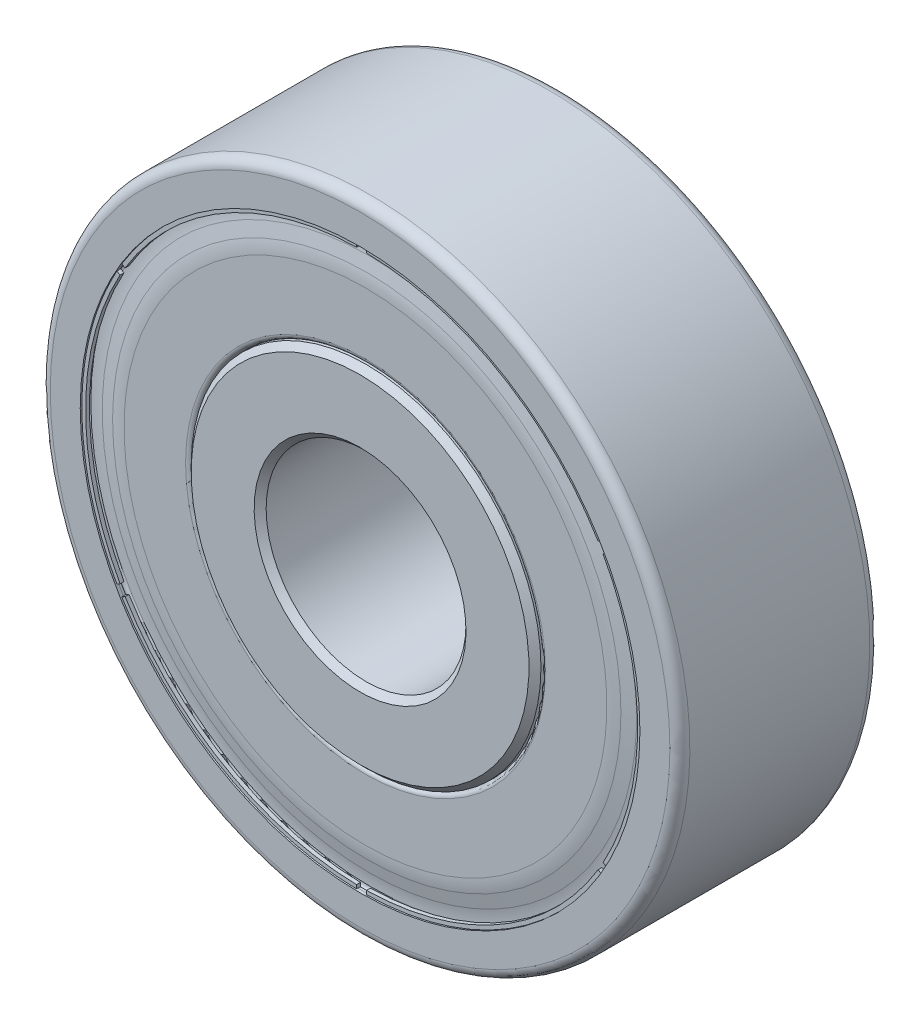
from build123d import *

# Parameters (mm, degrees)
CHAMFER1_SIZE      = 0.15
CIRPATTERN1_COUNT  = 6
CUT_EXTRUDE1_REACH = 14.354
CIRPATTERN2_COUNT  = 6


with BuildPart() as part:
    # Sketch3 → Revolve1 (revolve)
    with BuildSketch(Plane(origin=(0, 0, 0), x_dir=(0, 0, -1), z_dir=(1, 0, 0)), mode=Mode.PRIVATE) as revolve1_sk:
        with BuildLine():
            Line((-2.5, 2.5), (2.5, 2.5))
            Line((2.5, 2.5), (2.5, 4.375))
            Line((2.5, 4.375), (0.847791248, 4.375))
            ThreePointArc((0.847791248, 4.375), (0, 4.125), (-0.847791248, 4.375))
            Line((-0.847791248, 4.375), (-2.5, 4.375))
            Line((-2.5, 4.375), (-2.5, 2.5))
        make_face()
        with BuildLine():
            Line((2.5, 7), (2.425, 7))
            ThreePointArc((2.425, 7), (2.310894468, 7.124524337), (2.176899031, 7.021706022))
            Line((2.176899031, 7.021706022), (2.102540881, 6.6))
            Line((2.102540881, 6.6), (1.268365089, 6.6))
            ThreePointArc((1.268365089, 6.6), (0, 7.25), (-1.268365089, 6.6))
            Line((-1.268365089, 6.6), (-2.102540881, 6.6))
            Line((-2.102540881, 6.6), (-2.176899031, 7.021706022))
            ThreePointArc((-2.176899031, 7.021706022), (-2.310894468, 7.124524337), (-2.425, 7))
            Line((-2.425, 7), (-2.5, 7))
            Line((-2.5, 7), (-2.5, 7.75))
            ThreePointArc((-2.5, 7.75), (-2.426776695, 7.926776695), (-2.25, 8))
            Line((-2.25, 8), (2.25, 8))
            ThreePointArc((2.25, 8), (2.426776695, 7.926776695), (2.5, 7.75))
            Line((2.5, 7.75), (2.5, 7))
        make_face()
    revolve(revolve1_sk.sketch.rotate(Axis((0, 0, 2.5), (0, 0, -1)), 180), axis=Axis((0, 0, 2.5), (0, 0, -1)))

    # Chamfer1
    chamfer1_edges = [part.edges().sort_by_distance(p)[0] for p in [
        (0, 4.375, 2.5),
        (0, 4.375, -2.5),
        (0, 2.5, -2.5),
        (0, 2.5, 2.5),
    ]]
    chamfer(chamfer1_edges, length=CHAMFER1_SIZE)


with BuildPart() as body_2:
    # Sketch4 → Revolve2 (revolve)
    with BuildSketch(Plane(origin=(0, 0, 0), x_dir=(0, 0, -1), z_dir=(1, 0, 0)), mode=Mode.PRIVATE) as revolve2_sk:
        with BuildLine():
            Line((-2.425, 7), (-2.4625, 7))
            Line((-2.4625, 7), (-2.4625, 6.904))
            Line((-2.4625, 6.904), (-2.365, 6.904))
            Line((-2.365, 6.904), (-2.365, 7))
            ThreePointArc((-2.365, 7), (-2.3, 7.065), (-2.235, 7))
            Line((-2.235, 7), (-2.235, 6.84))
            Line((-2.235, 6.84), (-2.365, 6.2))
            Line((-2.365, 6.2), (-2.365, 4.5))
            ThreePointArc((-2.365, 4.5), (-2.328388348, 4.411611652), (-2.24, 4.375))
            Line((-2.24, 4.375), (-1.531666667, 4.375))
            Line((-1.531666667, 4.375), (-1.531666667, 4.435))
            Line((-1.531666667, 4.435), (-2.24, 4.435))
            ThreePointArc((-2.24, 4.435), (-2.285961941, 4.454038059), (-2.305, 4.5))
            Line((-2.305, 4.5), (-2.305, 6.2))
            Line((-2.305, 6.2), (-2.175, 6.84))
            Line((-2.175, 6.84), (-2.175, 7))
            ThreePointArc((-2.175, 7), (-2.3, 7.125), (-2.425, 7))
        make_face()
    revolve(revolve2_sk.sketch.rotate(Axis((0, 0, 2.5), (0, 0, -1)), 180), axis=Axis((0, 0, 2.5), (0, 0, -1)))

    # Fillet1: read off the stored shape, not the designer's step
    # Fillet1 outline → Fillet1 (revolve, cut)
    with BuildSketch(Plane.XZ):
        with BuildLine():
            Line((6.357638344, 2.365), (6.039142465, 2.365))
            ThreePointArc((6.039142465, 2.365), (6.199193179, 2.356974802), (6.357638344, 2.332979711))
            Line((6.357638344, 2.332979711), (6.357638344, 2.365))
        make_face()
    revolve(axis=Axis((0, 0, 0), (0, 0, 1)), mode=Mode.SUBTRACT)

    # Fillet1 2 outline → Fillet1 2 (revolve)
    with BuildSketch(Plane.XZ):
        with BuildLine():
            ThreePointArc((7, 2.235), (6.84038078, 2.243067972), (6.68236279, 2.267020058))
            Line((6.68236279, 2.267020058), (6.68236279, 2.235))
            Line((6.68236279, 2.235), (7, 2.235))
        make_face()
    revolve(axis=Axis((0, 0, 0), (0, 0, 1)))

    # Cut-Extrude1: up to this face of the body (flat: up to its plane)
    cut_extrude1_end = Plane(body_2.part.faces().sort_by_distance((0, 6.92379899, 2.365))[0])
    # Sketch6 → Cut-Extrude1 (cut, up to the picked face)
    with BuildSketch(Plane.XY.offset(2.4625), mode=Mode.PRIVATE) as cut_extrude1_sk1:
        with BuildLine():
            Line((-0.125, 6.99888384), (-0.125, 6.902868317))
            ThreePointArc((-0.125, 6.902868317), (0, 6.904), (0.125, 6.902868317))
            Line((0.125, 6.902868317), (0.125, 6.99888384))
            ThreePointArc((0.125, 6.99888384), (0, 7), (-0.125, 6.99888384))
        make_face()
    cut_extrude1_tool1 = split(extrude(cut_extrude1_sk1.sketch, amount=-CUT_EXTRUDE1_REACH, mode=Mode.PRIVATE), bisect_by=cut_extrude1_end, keep=Keep.BOTH, mode=Mode.PRIVATE)
    cut_extrude1 = cut_extrude1_tool1.solids().sort_by(Axis((0, 6.951625, 2.4625), (0, 0, -1)))[0]
    add(cut_extrude1, mode=Mode.SUBTRACT)

    # CirPattern2: Cut-Extrude1 ×6 about axis
    cirpattern2_axis = Axis((0, 0, 0), (0, 0, 1))
    for i in range(1, CIRPATTERN2_COUNT):
        add(cut_extrude1.rotate(cirpattern2_axis, i * 360 / CIRPATTERN2_COUNT), mode=Mode.SUBTRACT)


with BuildPart() as body_3:
    # Sketch5 → Revolve3 (revolve)
    with BuildSketch(Plane(origin=(0, 0, 0), x_dir=(0, 0, -1), z_dir=(1, 0, 0))):
        with BuildLine():
            Line((0, 7.25), (0, 4.125))
            ThreePointArc((0, 4.125), (1.5625, 5.6875), (0, 7.25))
        make_face()
    revolve(axis=Axis((0, 7.25, 0), (0, -1, 0)))


with BuildPart() as cirpattern1_1:
    # CirPattern1: pattern copy
    add(body_3.part.rotate(Axis((0, 0, 0), (0, 0, 1)), 1 * 360 / CIRPATTERN1_COUNT))


with BuildPart() as cirpattern1_2:
    # CirPattern1: pattern copy
    add(body_3.part.rotate(Axis((0, 0, 0), (0, 0, 1)), 2 * 360 / CIRPATTERN1_COUNT))


with BuildPart() as cirpattern1_3:
    # CirPattern1: pattern copy
    add(body_3.part.rotate(Axis((0, 0, 0), (0, 0, 1)), 3 * 360 / CIRPATTERN1_COUNT))


with BuildPart() as cirpattern1_4:
    # CirPattern1: pattern copy
    add(body_3.part.rotate(Axis((0, 0, 0), (0, 0, 1)), 4 * 360 / CIRPATTERN1_COUNT))


with BuildPart() as cirpattern1_5:
    # CirPattern1: pattern copy
    add(body_3.part.rotate(Axis((0, 0, 0), (0, 0, 1)), 5 * 360 / CIRPATTERN1_COUNT))


with BuildPart() as body_9:
    # Mirror2: mirrored copy
    add(body_2.part.mirror(Plane.XY))


solid = Compound([part.part, body_2.part, body_3.part, cirpattern1_1.part, cirpattern1_2.part, cirpattern1_3.part, cirpattern1_4.part, cirpattern1_5.part, body_9.part])
